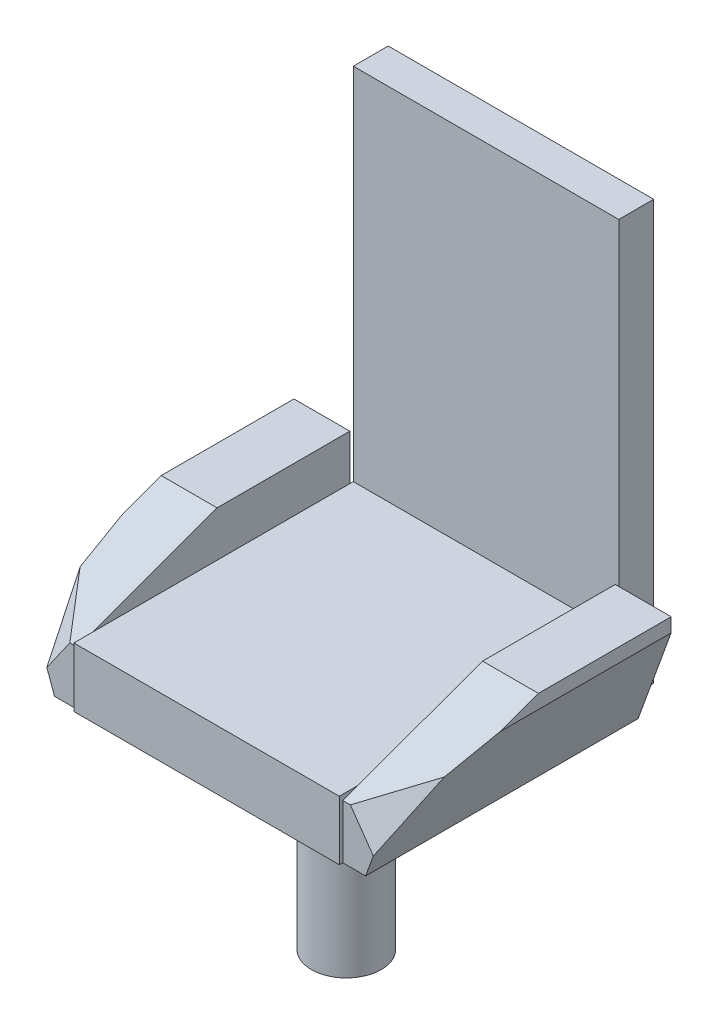
from build123d import *
from OCP.BRepFilletAPI import BRepFilletAPI_MakeChamfer

# Parameters (mm, degrees)
SKETCH1_W           = 380
SKETCH1_H           = 400
BOSS_EXTRUDE1_DEPTH = 85
SKETCH2_W           = 80
SKETCH2_H           = 390
BOSS_EXTRUDE2_DEPTH = 150
CHAMFER1_SIZE       = 72.794046853
CHAMFER1_SIZE_2     = 200
CHAMFER2_SIZE       = 130
CHAMFER2_SIZE2      = 47.316130455
SKETCH3_W           = 380
SKETCH3_H           = 600
BOSS_EXTRUDE3_DEPTH = 50
SKETCH4_R           = 50
BOSS_EXTRUDE4_DEPTH = 300
CHAMFER3_START      = 285.464373586
CHAMFER3_OUTLINE_W  = 79
CHAMFER3_OUTLINE_H  = 106
CHAMFER3_DEPTH      = 30.956619547
CHAMFER4_START      = -316.420993133
CHAMFER4_OUTLINE_W  = 79
CHAMFER4_OUTLINE_H  = 106
CHAMFER4_DEPTH      = 30.956619547


with BuildPart() as part:
    # Sketch1 → Boss-Extrude1 (new body)
    with BuildSketch(Plane(origin=(0, 0, 0), x_dir=(1, 0, 0), z_dir=(0, 1, 0))):
        Rectangle(SKETCH1_W, SKETCH1_H)
    extrude(amount=BOSS_EXTRUDE1_DEPTH)

    # Sketch2 → Boss-Extrude2 (add)
    with BuildSketch(Plane(origin=(0, 0, 0), x_dir=(1, 0, 0), z_dir=(0, 1, 0))):
        with Locations((-230, 0)):
            Rectangle(SKETCH2_W, SKETCH2_H)
        with Locations((230, 0)):
            Rectangle(SKETCH2_W, SKETCH2_H)
    extrude(amount=BOSS_EXTRUDE2_DEPTH)

    # Chamfer1
    # the kernel refuses this chamfer: 200, 72.794046853 mm, written as the material it takes off along each edge
    with BuildSketch(Plane(origin=(-788.83894651, 150, 195), x_dir=(0, -1, 0), z_dir=(1, 0, 0)), Plane(origin=(190, 150, 195), x_dir=(0, -1, 0), z_dir=(1, 0, 0))) as chamfer1_piece_1:
        Polygon((CHAMFER1_SIZE, 0), (0, CHAMFER1_SIZE_2), (0, 0), align=None)
    extrude(amount=598.83894651, mode=Mode.SUBTRACT)
    with BuildSketch(Plane(origin=(-788.83894651, 150, 195), x_dir=(0, -1, 0), z_dir=(1, 0, 0))) as chamfer1_piece_2_section:
        Polygon((CHAMFER1_SIZE, 0), (0, CHAMFER1_SIZE_2), (0, 0), align=None)
    chamfer1_piece_2 = extrude(amount=1117.67789302, mode=Mode.PRIVATE)
    chamfer1_piece_2 = split(chamfer1_piece_2, bisect_by=Plane(origin=(190, 150, 195), z_dir=(1, 0, 0)), keep=Keep.TOP, mode=Mode.PRIVATE)
    add(chamfer1_piece_2, mode=Mode.SUBTRACT)
    with BuildSketch(Plane(origin=(-328.83894651, 150, 195), x_dir=(0, -1, 0), z_dir=(1, 0, 0))) as chamfer1_piece_3_section:
        Polygon((CHAMFER1_SIZE, 0), (0, CHAMFER1_SIZE_2), (0, 0), align=None)
    chamfer1_piece_3 = extrude(amount=1117.67789302, mode=Mode.PRIVATE)
    chamfer1_piece_3 = split(chamfer1_piece_3, bisect_by=Plane(origin=(-190, 150, 195), z_dir=(-1, 0, 0)), keep=Keep.TOP, mode=Mode.PRIVATE)
    add(chamfer1_piece_3, mode=Mode.SUBTRACT)

    # Chamfer2: one chamfer whose edges measure the first distance from different faces: ONE call of the kernel's chamfer builder (chamfer() names one face for all edges)
    chamfer2_edges_1 = [part.edges().sort_by_distance(p)[0] for p in [
        (270, 0, 0),
    ]]
    chamfer2_side_1 = [part.faces().sort_by_distance(p)[0] for p in [
        (270, 67.789562339, -18.238567166),
    ]]
    chamfer2_edges_2 = [part.edges().sort_by_distance(p)[0] for p in [
        (-270, 0, 0),
    ]]
    chamfer2_side_2 = [part.faces().sort_by_distance(p)[0] for p in [
        (-270, 67.789562339, -18.238567166),
    ]]
    chamfer2 = BRepFilletAPI_MakeChamfer(part.part.solid().wrapped)
    for e in chamfer2_edges_1:
        chamfer2.Add(CHAMFER2_SIZE, CHAMFER2_SIZE2, e.wrapped, chamfer2_side_1[0].wrapped)  # the first distance lies on this face
    for e in chamfer2_edges_2:
        chamfer2.Add(CHAMFER2_SIZE, CHAMFER2_SIZE2, e.wrapped, chamfer2_side_2[0].wrapped)  # the first distance lies on this face
    add(Compound.cast(chamfer2.Shape()), mode=Mode.REPLACE)

    # Sketch3 → Boss-Extrude3 (add)
    with BuildSketch(Plane(origin=(0, 0, -200), x_dir=(-1, 0, 0), z_dir=(0, 0, -1))):
        with Locations((0, 300)):
            Rectangle(SKETCH3_W, SKETCH3_H)
    extrude(amount=BOSS_EXTRUDE3_DEPTH)

    # Sketch4 → Boss-Extrude4 (add)
    with BuildSketch(Plane.XZ):
        with Locations(Location((0, 0, 0), (0, 0, 270))):
            Circle(SKETCH4_R)
    extrude(amount=BOSS_EXTRUDE4_DEPTH)

    # Chamfer3: read off the stored shape, not the designer's step
    # Chamfer3 outline → Chamfer3 (cut)
    with BuildSketch(Plane(origin=(0, 0, 0), x_dir=(0.7852866244263759, -0.34179494272055927, -0.5162374789064406), z_dir=(0.6191323909286511, 0.433521167278043, 0.6547781914701)).offset(CHAMFER3_START)):
        with Locations((68.5, -31)):
            Rectangle(CHAMFER3_OUTLINE_W, CHAMFER3_OUTLINE_H)
    extrude(amount=CHAMFER3_DEPTH, mode=Mode.SUBTRACT)

    # Chamfer4: read off the stored shape, not the designer's step
    # Chamfer4 outline → Chamfer4 (cut)
    with BuildSketch(Plane(origin=(0, 0, 0), x_dir=(0.7852866244263759, 0.34179494272055927, 0.5162374789064406), z_dir=(0.6191323909286511, -0.433521167278043, -0.6547781914701)).offset(CHAMFER4_START)):
        with Locations((-68.5, 31)):
            Rectangle(CHAMFER4_OUTLINE_W, CHAMFER4_OUTLINE_H)
    extrude(amount=CHAMFER4_DEPTH, mode=Mode.SUBTRACT)


solid = part.part
